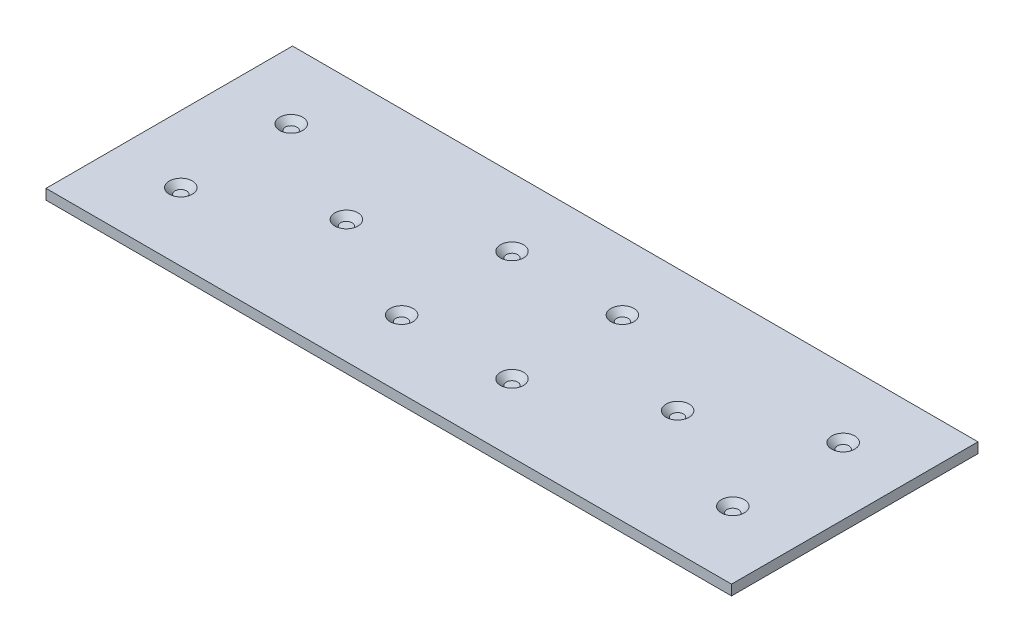
from build123d import *

# Parameters (mm, degrees)
SKETCH1_W                  = 267
SKETCH1_H                  = 96
BOSS_EXTRUDE1_DEPTH        = 4
ADVANCEDHOLE2_OUTLINE_R    = 2.25
ADVANCEDHOLE2_DEPTH        = 2.23
ADVANCEDHOLE2_DRAFT        = -45
ADVANCEDHOLE2_2_OUTLINE_R  = 2.25
ADVANCEDHOLE2_2_DEPTH      = 2.23
ADVANCEDHOLE2_2_DRAFT      = -45
ADVANCEDHOLE2_3_OUTLINE_R  = 2.25
ADVANCEDHOLE2_3_DEPTH      = 2.23
ADVANCEDHOLE2_3_DRAFT      = -45
ADVANCEDHOLE2_4_OUTLINE_R  = 2.25
ADVANCEDHOLE2_4_DEPTH      = 2.23
ADVANCEDHOLE2_4_DRAFT      = -45
ADVANCEDHOLE2_5_OUTLINE_R  = 2.25
ADVANCEDHOLE2_5_DEPTH      = 2.23
ADVANCEDHOLE2_5_DRAFT      = -45
ADVANCEDHOLE2_6_OUTLINE_R  = 2.25
ADVANCEDHOLE2_6_DEPTH      = 2.23
ADVANCEDHOLE2_6_DRAFT      = -45
ADVANCEDHOLE2_7_OUTLINE_R  = 2.25
ADVANCEDHOLE2_7_DEPTH      = 2.23
ADVANCEDHOLE2_7_DRAFT      = -45
ADVANCEDHOLE2_8_OUTLINE_R  = 2.25
ADVANCEDHOLE2_8_DEPTH      = 2.23
ADVANCEDHOLE2_8_DRAFT      = -45
ADVANCEDHOLE2_9_OUTLINE_R  = 2.25
ADVANCEDHOLE2_9_DEPTH      = 2.23
ADVANCEDHOLE2_9_DRAFT      = -45
ADVANCEDHOLE2_10_OUTLINE_R = 2.25
ADVANCEDHOLE2_10_DEPTH     = 2.23
ADVANCEDHOLE2_10_DRAFT     = -45


# Read off the part's stored shape, not the designer's step: AdvancedHole2
with BuildPart() as part:
    # Sketch1 → Boss-Extrude1 (new body)
    with BuildSketch(Plane(origin=(0, 0, 0), x_dir=(1, 0, 0), z_dir=(0, 1, 0))):
        with Locations((133.5, 48)):
            Rectangle(SKETCH1_W, SKETCH1_H)
    extrude(amount=BOSS_EXTRUDE1_DEPTH)


with BuildPart() as advancedhole2_tool:
    # AdvancedHole2 outline → AdvancedHole2 (with draft: the straight prism first)
    with BuildSketch(Plane(origin=(0, 1.77, 0), x_dir=(1, 0, 0), z_dir=(0, 1, 0))):
        with Locations((241, 26.5)):
            Circle(ADVANCEDHOLE2_OUTLINE_R)
    extrude(amount=ADVANCEDHOLE2_DEPTH)
    # AdvancedHole2: the draft: its side faces are tilted about the plane it starts from
    advancedhole2_sides = [advancedhole2_tool.faces().sort_by_distance(p)[0] for p in [
        (238.75, 2.885, -26.5),
    ]]
    draft(advancedhole2_sides, Plane(origin=(0, 1.77, 0), x_dir=(1, 0, 0), z_dir=(0, 1, 0)), ADVANCEDHOLE2_DRAFT)


with BuildPart() as part_1:
    add(part.part)

    # AdvancedHole2: cut by advancedhole2_tool
    add(advancedhole2_tool.part, mode=Mode.SUBTRACT)


with BuildPart() as advancedhole2_2_tool:
    # AdvancedHole2 2 outline → AdvancedHole2 2 (with draft: the straight prism first)
    with BuildSketch(Plane(origin=(0, 1.77, 0), x_dir=(1, 0, 0), z_dir=(0, 1, 0))):
        with Locations((198, 48)):
            Circle(ADVANCEDHOLE2_2_OUTLINE_R)
    extrude(amount=ADVANCEDHOLE2_2_DEPTH)
    # AdvancedHole2 2: the draft: its side faces are tilted about the plane it starts from
    advancedhole2_2_sides = [advancedhole2_2_tool.faces().sort_by_distance(p)[0] for p in [
        (195.75, 2.885, -48),
    ]]
    draft(advancedhole2_2_sides, Plane(origin=(0, 1.77, 0), x_dir=(1, 0, 0), z_dir=(0, 1, 0)), ADVANCEDHOLE2_2_DRAFT)


with BuildPart() as part_2:
    add(part_1.part)

    # AdvancedHole2 2: cut by advancedhole2_2_tool
    add(advancedhole2_2_tool.part, mode=Mode.SUBTRACT)


with BuildPart() as advancedhole2_3_tool:
    # AdvancedHole2 3 outline → AdvancedHole2 3 (with draft: the straight prism first)
    with BuildSketch(Plane(origin=(0, 1.77, 0), x_dir=(1, 0, 0), z_dir=(0, 1, 0))):
        with Locations((241, 69.5)):
            Circle(ADVANCEDHOLE2_3_OUTLINE_R)
    extrude(amount=ADVANCEDHOLE2_3_DEPTH)
    # AdvancedHole2 3: the draft: its side faces are tilted about the plane it starts from
    advancedhole2_3_sides = [advancedhole2_3_tool.faces().sort_by_distance(p)[0] for p in [
        (238.75, 2.885, -69.5),
    ]]
    draft(advancedhole2_3_sides, Plane(origin=(0, 1.77, 0), x_dir=(1, 0, 0), z_dir=(0, 1, 0)), ADVANCEDHOLE2_3_DRAFT)


with BuildPart() as part_3:
    add(part_2.part)

    # AdvancedHole2 3: cut by advancedhole2_3_tool
    add(advancedhole2_3_tool.part, mode=Mode.SUBTRACT)


with BuildPart() as advancedhole2_4_tool:
    # AdvancedHole2 4 outline → AdvancedHole2 4 (with draft: the straight prism first)
    with BuildSketch(Plane(origin=(0, 1.77, 0), x_dir=(1, 0, 0), z_dir=(0, 1, 0))):
        with Locations((155, 69.5)):
            Circle(ADVANCEDHOLE2_4_OUTLINE_R)
    extrude(amount=ADVANCEDHOLE2_4_DEPTH)
    # AdvancedHole2 4: the draft: its side faces are tilted about the plane it starts from
    advancedhole2_4_sides = [advancedhole2_4_tool.faces().sort_by_distance(p)[0] for p in [
        (152.75, 2.885, -69.5),
    ]]
    draft(advancedhole2_4_sides, Plane(origin=(0, 1.77, 0), x_dir=(1, 0, 0), z_dir=(0, 1, 0)), ADVANCEDHOLE2_4_DRAFT)


with BuildPart() as part_4:
    add(part_3.part)

    # AdvancedHole2 4: cut by advancedhole2_4_tool
    add(advancedhole2_4_tool.part, mode=Mode.SUBTRACT)


with BuildPart() as advancedhole2_5_tool:
    # AdvancedHole2 5 outline → AdvancedHole2 5 (with draft: the straight prism first)
    with BuildSketch(Plane(origin=(0, 1.77, 0), x_dir=(1, 0, 0), z_dir=(0, 1, 0))):
        with Locations((155, 26.5)):
            Circle(ADVANCEDHOLE2_5_OUTLINE_R)
    extrude(amount=ADVANCEDHOLE2_5_DEPTH)
    # AdvancedHole2 5: the draft: its side faces are tilted about the plane it starts from
    advancedhole2_5_sides = [advancedhole2_5_tool.faces().sort_by_distance(p)[0] for p in [
        (152.75, 2.885, -26.5),
    ]]
    draft(advancedhole2_5_sides, Plane(origin=(0, 1.77, 0), x_dir=(1, 0, 0), z_dir=(0, 1, 0)), ADVANCEDHOLE2_5_DRAFT)


with BuildPart() as part_5:
    add(part_4.part)

    # AdvancedHole2 5: cut by advancedhole2_5_tool
    add(advancedhole2_5_tool.part, mode=Mode.SUBTRACT)


with BuildPart() as advancedhole2_6_tool:
    # AdvancedHole2 6 outline → AdvancedHole2 6 (with draft: the straight prism first)
    with BuildSketch(Plane(origin=(0, 1.77, 0), x_dir=(1, 0, 0), z_dir=(0, 1, 0))):
        with Locations((112, 26.5)):
            Circle(ADVANCEDHOLE2_6_OUTLINE_R)
    extrude(amount=ADVANCEDHOLE2_6_DEPTH)
    # AdvancedHole2 6: the draft: its side faces are tilted about the plane it starts from
    advancedhole2_6_sides = [advancedhole2_6_tool.faces().sort_by_distance(p)[0] for p in [
        (109.75, 2.885, -26.5),
    ]]
    draft(advancedhole2_6_sides, Plane(origin=(0, 1.77, 0), x_dir=(1, 0, 0), z_dir=(0, 1, 0)), ADVANCEDHOLE2_6_DRAFT)


with BuildPart() as part_6:
    add(part_5.part)

    # AdvancedHole2 6: cut by advancedhole2_6_tool
    add(advancedhole2_6_tool.part, mode=Mode.SUBTRACT)


with BuildPart() as advancedhole2_7_tool:
    # AdvancedHole2 7 outline → AdvancedHole2 7 (with draft: the straight prism first)
    with BuildSketch(Plane(origin=(0, 1.77, 0), x_dir=(1, 0, 0), z_dir=(0, 1, 0))):
        with Locations((112, 69.5)):
            Circle(ADVANCEDHOLE2_7_OUTLINE_R)
    extrude(amount=ADVANCEDHOLE2_7_DEPTH)
    # AdvancedHole2 7: the draft: its side faces are tilted about the plane it starts from
    advancedhole2_7_sides = [advancedhole2_7_tool.faces().sort_by_distance(p)[0] for p in [
        (109.75, 2.885, -69.5),
    ]]
    draft(advancedhole2_7_sides, Plane(origin=(0, 1.77, 0), x_dir=(1, 0, 0), z_dir=(0, 1, 0)), ADVANCEDHOLE2_7_DRAFT)


with BuildPart() as part_7:
    add(part_6.part)

    # AdvancedHole2 7: cut by advancedhole2_7_tool
    add(advancedhole2_7_tool.part, mode=Mode.SUBTRACT)


with BuildPart() as advancedhole2_8_tool:
    # AdvancedHole2 8 outline → AdvancedHole2 8 (with draft: the straight prism first)
    with BuildSketch(Plane(origin=(0, 1.77, 0), x_dir=(1, 0, 0), z_dir=(0, 1, 0))):
        with Locations((69, 48)):
            Circle(ADVANCEDHOLE2_8_OUTLINE_R)
    extrude(amount=ADVANCEDHOLE2_8_DEPTH)
    # AdvancedHole2 8: the draft: its side faces are tilted about the plane it starts from
    advancedhole2_8_sides = [advancedhole2_8_tool.faces().sort_by_distance(p)[0] for p in [
        (66.75, 2.885, -48),
    ]]
    draft(advancedhole2_8_sides, Plane(origin=(0, 1.77, 0), x_dir=(1, 0, 0), z_dir=(0, 1, 0)), ADVANCEDHOLE2_8_DRAFT)


with BuildPart() as part_8:
    add(part_7.part)

    # AdvancedHole2 8: cut by advancedhole2_8_tool
    add(advancedhole2_8_tool.part, mode=Mode.SUBTRACT)


with BuildPart() as advancedhole2_9_tool:
    # AdvancedHole2 9 outline → AdvancedHole2 9 (with draft: the straight prism first)
    with BuildSketch(Plane(origin=(0, 1.77, 0), x_dir=(1, 0, 0), z_dir=(0, 1, 0))):
        with Locations((26, 26.5)):
            Circle(ADVANCEDHOLE2_9_OUTLINE_R)
    extrude(amount=ADVANCEDHOLE2_9_DEPTH)
    # AdvancedHole2 9: the draft: its side faces are tilted about the plane it starts from
    advancedhole2_9_sides = [advancedhole2_9_tool.faces().sort_by_distance(p)[0] for p in [
        (23.75, 2.885, -26.5),
    ]]
    draft(advancedhole2_9_sides, Plane(origin=(0, 1.77, 0), x_dir=(1, 0, 0), z_dir=(0, 1, 0)), ADVANCEDHOLE2_9_DRAFT)


with BuildPart() as part_9:
    add(part_8.part)

    # AdvancedHole2 9: cut by advancedhole2_9_tool
    add(advancedhole2_9_tool.part, mode=Mode.SUBTRACT)


with BuildPart() as advancedhole2_10_tool:
    # AdvancedHole2 10 outline → AdvancedHole2 10 (with draft: the straight prism first)
    with BuildSketch(Plane(origin=(0, 1.77, 0), x_dir=(1, 0, 0), z_dir=(0, 1, 0))):
        with Locations((26, 69.5)):
            Circle(ADVANCEDHOLE2_10_OUTLINE_R)
    extrude(amount=ADVANCEDHOLE2_10_DEPTH)
    # AdvancedHole2 10: the draft: its side faces are tilted about the plane it starts from
    advancedhole2_10_sides = [advancedhole2_10_tool.faces().sort_by_distance(p)[0] for p in [
        (23.75, 2.885, -69.5),
    ]]
    draft(advancedhole2_10_sides, Plane(origin=(0, 1.77, 0), x_dir=(1, 0, 0), z_dir=(0, 1, 0)), ADVANCEDHOLE2_10_DRAFT)


with BuildPart() as part_10:
    add(part_9.part)

    # AdvancedHole2 10: cut by advancedhole2_10_tool
    add(advancedhole2_10_tool.part, mode=Mode.SUBTRACT)


solid = part_10.part
